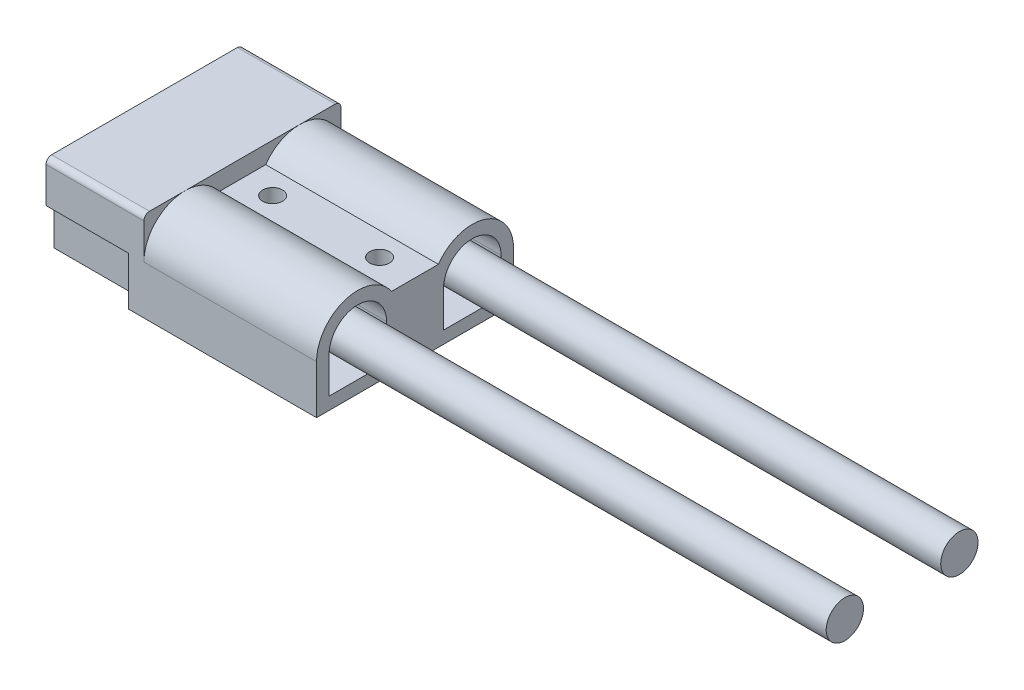
from build123d import *

# Parameters (mm, degrees)
EXTRUDE1_DEPTH  = 30.62
SKETCH2_W       = 34.93
SKETCH2_H       = 15.9
SKETCH2_W_2     = 10.2
SKETCH2_H_2     = 6.39
EXTRUDE2_DEPTH  = 2.76
EXTRUDE3_DEPTH  = 15.36
EXTRUDE4_DEPTH  = 15.36
FILLET1_R       = 1
SKETCH4_R       = 3.31
EXTRUDE5_DEPTH  = 117
HOLE1_OUTLINE_R = 1.755
HOLE1_DEPTH     = 12.75
LPATTERN1_COUNT = 2
LPATTERN1_PITCH = 18.97


# Read off the part's stored shape, not the designer's step: Hole1
with BuildPart() as part:
    # Sketch1 → Extrude1 (new body)
    with BuildSketch(Plane(origin=(0, 0, 0), x_dir=(0, 0, -1), z_dir=(1, 0, 0))):
        with BuildLine():
            Line((4.144134838, 12.75), (-4.144134838, 12.75))
            ThreePointArc((-4.144134838, 12.75), (-12.334068111, 15.567661655), (-17.465, 8.59))
            Line((-17.465, 8.59), (-17.465, 0))
            Line((-17.465, 0), (17.465, 0))
            Line((17.465, 0), (17.465, 8.59))
            ThreePointArc((17.465, 8.59), (12.334068111, 15.567661655), (4.144134838, 12.75))
        make_face()
        with BuildLine():
            Line((-15.255, 8.59), (-15.255, 2.2))
            Line((-15.255, 2.2), (-5.055, 2.2))
            Line((-5.055, 2.2), (-5.055, 8.59))
            ThreePointArc((-5.055, 8.59), (-10.155, 13.69), (-15.255, 8.59))
        make_face(mode=Mode.SUBTRACT)
        with BuildLine():
            Line((5.055, 2.2), (5.055, 8.59))
            ThreePointArc((5.055, 8.59), (10.155, 13.69), (15.255, 8.59))
            Line((15.255, 8.59), (15.255, 2.2))
            Line((15.255, 2.2), (5.055, 2.2))
        make_face(mode=Mode.SUBTRACT)
    extrude(amount=-EXTRUDE1_DEPTH)

    # Sketch2 → Extrude2 (add)
    with BuildSketch(Plane.ZY.offset(30.62)):
        with Locations((0, 7.95)):
            Rectangle(SKETCH2_W, SKETCH2_H)
        with Locations((-10.155, 5.395)):
            Rectangle(SKETCH2_W_2, SKETCH2_H_2, mode=Mode.SUBTRACT)
        with Locations((10.155, 5.395)):
            Rectangle(SKETCH2_W_2, SKETCH2_H_2, mode=Mode.SUBTRACT)
    extrude(amount=EXTRUDE2_DEPTH)

    # Sketch3 → Extrude3 (add)
    with BuildSketch(Plane.ZY.offset(32.62)):
        Polygon((0, 10.53), (0, 15.9), (-17.465, 15.9), (-17.465, 8.59), (-16.045, 8.59), (-16.045, 14.48), (-3.07, 14.48), (-3.07, 10.53), align=None)
        Polygon((17.465, 15.9), (0, 15.9), (0, 10.53), (3.07, 10.53), (3.07, 14.48), (16.045, 14.48), (16.045, 8.59), (17.465, 8.59), align=None)
    extrude(amount=EXTRUDE3_DEPTH)

    # Fillet1
    fillet1_edges = [part.edges().sort_by_distance(p)[0] for p in [
        (-39.3, 15.9, -17.465),
        (-39.3, 15.9, 17.465),
    ]]
    fillet(fillet1_edges, radius=FILLET1_R)

    # Sketch4 → Extrude5 (add)
    with BuildSketch(Plane(origin=(-30.62, 0, 0), x_dir=(0, 0, -1), z_dir=(1, 0, 0))):
        with Locations((-10.155, 8.59)):
            Circle(SKETCH4_R)
        with Locations(Location((10.155, 8.59, 0), (0, 0, 180))):
            Circle(SKETCH4_R)
    extrude(amount=EXTRUDE5_DEPTH)

    # Hole1 outline → Hole1 (cut)
    with BuildSketch(Plane(origin=(0, 0, 0), x_dir=(1, 0, 0), z_dir=(0, 1, 0))):
        with Locations((-6.29, 0)):
            Circle(HOLE1_OUTLINE_R)
    hole1 = extrude(amount=HOLE1_DEPTH, mode=Mode.SUBTRACT)

    # LPattern1: Hole1 ×2
    with Locations(*[(-i * LPATTERN1_PITCH, 0, 0) for i in range(1, LPATTERN1_COUNT)]):
        add(hole1, mode=Mode.SUBTRACT)


with BuildPart() as body_2:
    # Sketch → Extrude4 (new body)
    with BuildSketch(Plane.ZY.offset(32.62)):
        Polygon((0, 6.66), (0, 8.59), (-4.69, 8.59), (-4.69, 6.91), (-14.755, 6.91), (-14.755, 8.59), (-16.045, 8.59), (-16.045, 1.37), (-3.645, 1.37), (-3.645, 6.66), align=None)
        Polygon((4.69, 8.59), (0, 8.59), (0, 6.66), (3.645, 6.66), (3.645, 1.37), (16.045, 1.37), (16.045, 8.59), (14.755, 8.59), (14.755, 6.91), (4.69, 6.91), align=None)
    extrude(amount=EXTRUDE4_DEPTH)


solid = Compound([part.part, body_2.part])
